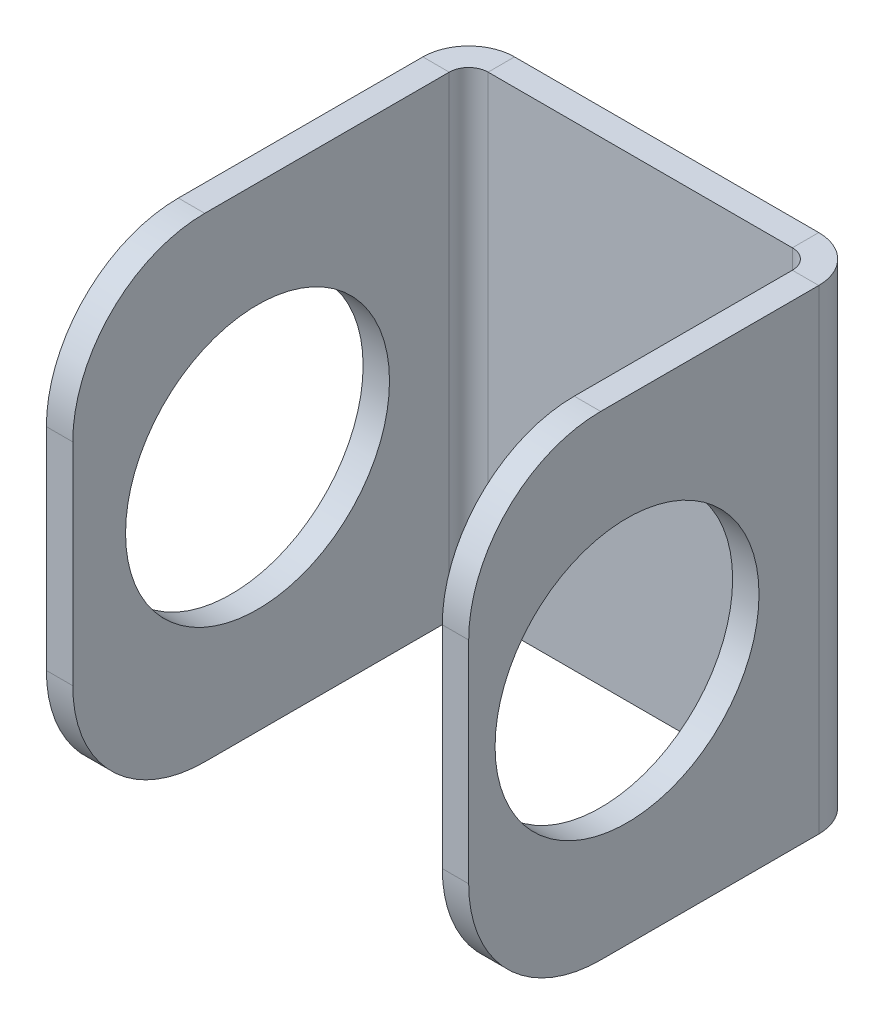
from build123d import *

# Parameters (mm, degrees)
SKETCH2_W                    = 15
SKETCH2_H                    = 18
BASE_FLANGE1_DEPTH           = 1
EDGE_FLANGE1_STRIP_W         = 5.4732
EDGE_FLANGE1_STRIP_H         = 1
EDGE_FLANGE1_STRIP_CUT_DEPTH = 18
EDGE_FLANGE1_DEPTH           = 18
EDGE_FLANGE2_STRIP_W         = 5.4732
EDGE_FLANGE2_STRIP_H         = 1
EDGE_FLANGE2_STRIP_CUT_DEPTH = 18
EDGE_FLANGE2_DEPTH           = 18
SKETCH13_R                   = 5
CUT_EXTRUDE1_DEPTH           = 24.043437244
FILLET1_R                    = 5


# Sheet-metal steps are written as plain solids
with BuildPart() as part:
    # Sketch2 → Base-Flange1 (new body)
    with BuildSketch(Plane.XY):
        Rectangle(SKETCH2_W, SKETCH2_H)
    extrude(amount=-BASE_FLANGE1_DEPTH)

    # Edge-Flange1 strip (across the edge) → Edge-Flange1 strip cut (cut)
    with BuildSketch(Plane(origin=(7.5, -9, 0), x_dir=(-1, 0, 0), z_dir=(0, 1, 0))):
        with Locations((-1, -0.5)):
            Rectangle(EDGE_FLANGE1_STRIP_W, EDGE_FLANGE1_STRIP_H)
    extrude(amount=EDGE_FLANGE1_STRIP_CUT_DEPTH, mode=Mode.SUBTRACT)

    # Edge-Flange1 section (across the edge) → Edge-Flange1 (add)
    with BuildSketch(Plane(origin=(7.5, -9, 0), x_dir=(-1, 0, 0), z_dir=(0, 1, 0))):
        with BuildLine():
            Line((0, 0.7366), (0, 14))
            Line((0, 14), (1, 14))
            Line((1, 14), (1, 0.7366))
            ThreePointArc((1, 0.7366), (1.215745145, 0.215745145), (1.7366, 0))
            Line((1.7366, 0), (1.7366, -1))
            ThreePointArc((1.7366, -1), (0.508638364, -0.491361636), (0, 0.7366))
        make_face()
    extrude(amount=EDGE_FLANGE1_DEPTH)

    # Edge-Flange2 strip (across the edge) → Edge-Flange2 strip cut (cut)
    with BuildSketch(Plane(origin=(-7.5, 9, 0), x_dir=(1, 0, 0), z_dir=(0, -1, 0))):
        with Locations((-1, -0.5)):
            Rectangle(EDGE_FLANGE2_STRIP_W, EDGE_FLANGE2_STRIP_H)
    extrude(amount=EDGE_FLANGE2_STRIP_CUT_DEPTH, mode=Mode.SUBTRACT)

    # Edge-Flange2 section (across the edge) → Edge-Flange2 (add)
    with BuildSketch(Plane(origin=(-7.5, 9, 0), x_dir=(1, 0, 0), z_dir=(0, -1, 0))):
        with BuildLine():
            Line((0, 0.7366), (0, 15))
            Line((0, 15), (1, 15))
            Line((1, 15), (1, 0.7366))
            ThreePointArc((1, 0.7366), (1.215745145, 0.215745145), (1.7366, 0))
            Line((1.7366, 0), (1.7366, -1))
            ThreePointArc((1.7366, -1), (0.508638364, -0.491361636), (0, 0.7366))
        make_face()
    extrude(amount=EDGE_FLANGE2_DEPTH)

    # Sketch13 → Cut-Extrude1 (cut, through all)
    with BuildSketch(Plane.ZY.offset(7.5)):
        with Locations((8, 0)):
            Circle(SKETCH13_R)
    extrude(amount=-CUT_EXTRUDE1_DEPTH, mode=Mode.SUBTRACT)

    # Fillet1
    fillet1_edges = [part.edges().sort_by_distance(p)[0] for p in [
        (7, -9, 14),
        (7, 9, 14),
        (-7, 9, 15),
        (-7, -9, 15),
    ]]
    fillet(fillet1_edges, radius=FILLET1_R)


solid = part.part
